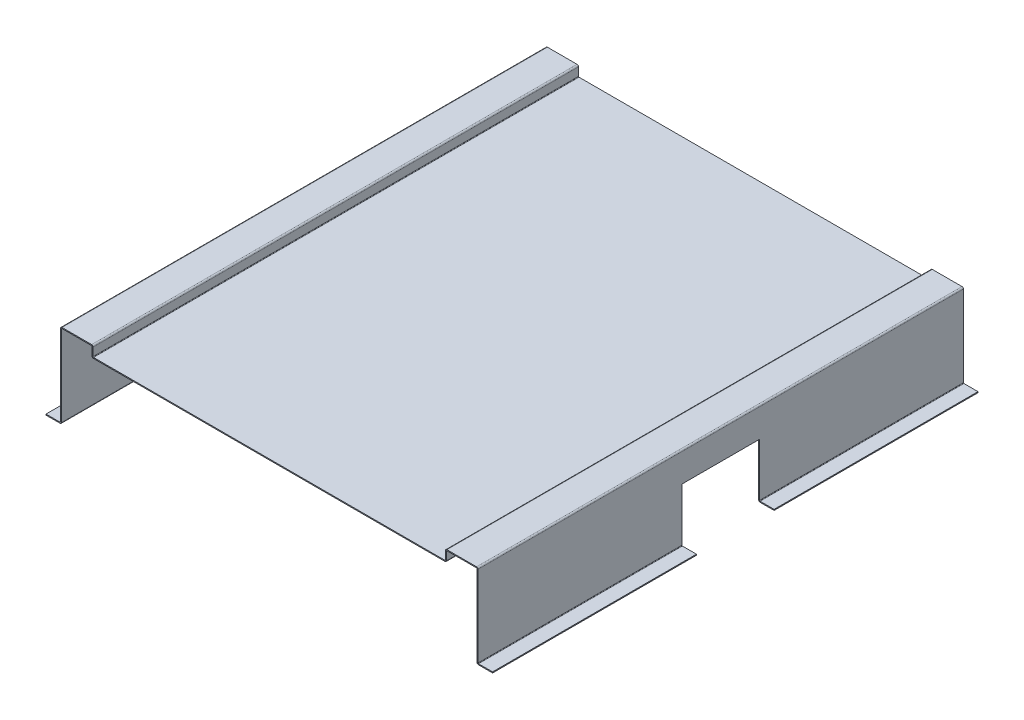
from build123d import *

# Parameters (mm, degrees)
SKETCH_1_W             = 181
SKETCH_1_H             = 500
SM_BASE_FLANGE_1_DEPTH = 1
SM_EDGE_FLANGE_1_DEPTH = 500
SM_EDGE_FLANGE_2_DEPTH = 500
SM_EDGE_FLANGE_3_DEPTH = 500
SM_EDGE_FLANGE_4_DEPTH = 500
SKETCH_18_W            = 80
SKETCH_18_H            = 71.447403799
CUT_EXTRUDE_1_DEPTH    = 100


# Sheet-metal steps are written as plain solids
with BuildPart() as part:
    # Sketch 1 → 基体-法兰1 (new body)
    with BuildSketch(Plane(origin=(0, 0, 0), x_dir=(1, 0, 0), z_dir=(0, 1, 0))):
        with Locations((-90.5, 0)):
            Rectangle(SKETCH_1_W, SKETCH_1_H)
    extrude(amount=-SM_BASE_FLANGE_1_DEPTH)

    # 边线-法兰1 section (across the edge) → 边线-法兰1 (add)
    with BuildSketch(Plane(origin=(-181.5, 0, -250), x_dir=(1, 0, 0), z_dir=(0, 0, 1))):
        with BuildLine():
            Line((-1, 0.5), (-1, 9))
            Line((-1, 9), (0, 9))
            Line((0, 9), (0, 0.5))
            ThreePointArc((0, 0.5), (0.146446609, 0.146446609), (0.5, 0))
            Line((0.5, 0), (0.5, -1))
            ThreePointArc((0.5, -1), (-0.560660172, -0.560660172), (-1, 0.5))
        make_face()
    extrude(amount=SM_EDGE_FLANGE_1_DEPTH)

    # 边线-法兰2 section (across the edge) → 边线-法兰2 (add)
    with BuildSketch(Plane(origin=(-182.5, 9.5, 250), x_dir=(0, -1, 0), z_dir=(0, 0, -1))):
        with BuildLine():
            Line((-1, 0.5), (-1, 31))
            Line((-1, 31), (0, 31))
            Line((0, 31), (0, 0.5))
            ThreePointArc((0, 0.5), (0.146446609, 0.146446609), (0.5, 0))
            Line((0.5, 0), (0.5, -1))
            ThreePointArc((0.5, -1), (-0.560660172, -0.560660172), (-1, 0.5))
        make_face()
    extrude(amount=SM_EDGE_FLANGE_2_DEPTH)

    # 边线-法兰3 section (across the edge) → 边线-法兰3 (add)
    with BuildSketch(Plane(origin=(-214, 9.5, 250), x_dir=(1, 0, 0), z_dir=(0, 0, -1))):
        with BuildLine():
            Line((-1, 0.5), (-1, 84))
            Line((-1, 84), (0, 84))
            Line((0, 84), (0, 0.5))
            ThreePointArc((0, 0.5), (0.146446609, 0.146446609), (0.5, 0))
            Line((0.5, 0), (0.5, -1))
            ThreePointArc((0.5, -1), (-0.560660172, -0.560660172), (-1, 0.5))
        make_face()
    extrude(amount=SM_EDGE_FLANGE_3_DEPTH)

    # 边线-法兰4 section (across the edge) → 边线-法兰4 (add)
    with BuildSketch(Plane(origin=(-215, -75, -250), x_dir=(0, 1, 0), z_dir=(0, 0, 1))):
        with BuildLine():
            Line((-1, 0.5), (-1, 15))
            Line((-1, 15), (0, 15))
            Line((0, 15), (0, 0.5))
            ThreePointArc((0, 0.5), (0.146446609, 0.146446609), (0.5, 0))
            Line((0.5, 0), (0.5, -1))
            ThreePointArc((0.5, -1), (-0.560660172, -0.560660172), (-1, 0.5))
        make_face()
    extrude(amount=SM_EDGE_FLANGE_4_DEPTH)

    # 草图18 → 切除-拉伸1 (cut)
    with BuildSketch(Plane.ZY.offset(230)):
        with Locations((0, -55.723701899)):
            Rectangle(SKETCH_18_W, SKETCH_18_H)
    extrude(amount=-CUT_EXTRUDE_1_DEPTH, mode=Mode.SUBTRACT)

    # 镜向1: part across plane


with BuildPart() as part_1:
    add(part.part)
    add(part.part.mirror(Plane(origin=(0, -1, -250), x_dir=(0, 0, 1), z_dir=(1, 0, 0))))


solid = part_1.part
